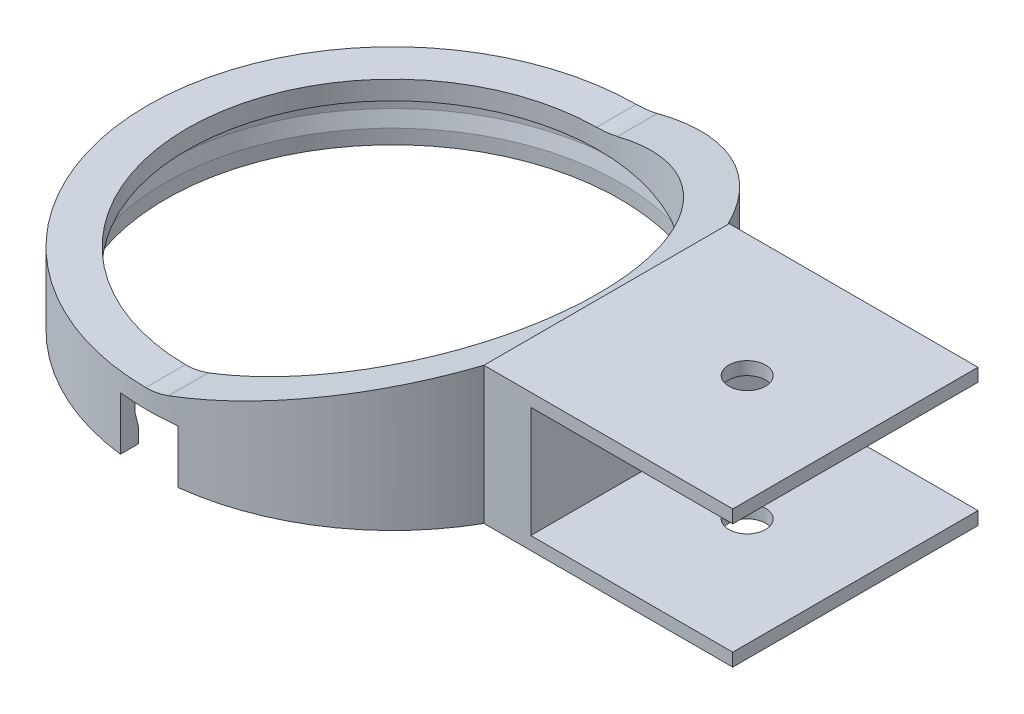
from build123d import *
from build123d.topology import SkipClean

# Parameters (mm, degrees)
SKETCH1_R                = 43.18
SKETCH1_R_2              = 38.1
SKETCH1_R_3              = 36.195
BOSS_EXTRUDE1_DEPTH      = 2.54
BOSS_EXTRUDE2_START      = 4.318
SKETCH2_R                = 43.18
SKETCH2_R_2              = 40.64
BOSS_EXTRUDE2_DEPTH      = 4.318
SKETCH7_W                = 5.08
SKETCH7_H                = 10.16
CUT_EXTRUDE1_DEPTH       = 12.7
SKETCH12_R               = 43.18
SKETCH12_R_2             = 36.195
BOSS_EXTRUDE3_DEPTH      = 12.192
BOSS_EXTRUDE4_REACH      = 99.671
BOSS_EXTRUDE4_END_RADIUS = 43.18
SKETCH13_W               = 43.18
SKETCH13_H               = 24.13
BOSS_EXTRUDE5_DEPTH      = 38.1
SKETCH14_W               = 38.608
SKETCH14_H               = 19.558
CUT_EXTRUDE2_DEPTH       = 35.56
SKETCH17_R               = 3.2385
CUT_EXTRUDE3_DEPTH       = 35.56
CUT_EXTRUDE5_DEPTH       = 88.9
FILLET1_R                = 12.7
SKETCH23_W               = 35.56
SKETCH23_H               = 19.558
CUT_EXTRUDE6_DEPTH       = 50.8


with BuildPart() as part:
    # Sketch1 → Boss-Extrude1 (new body)
    # profile 1 of 2: a face of its own
    with BuildSketch(Plane(origin=(0, 0, 0), x_dir=(1, 0, 0), z_dir=(0, 1, 0))):
        with Locations(Location((0, 0, 0), (0, 0, 270))):
            Circle(SKETCH1_R)
        Circle(SKETCH1_R_2, mode=Mode.SUBTRACT)
    # profile 2 of 2: a face of its own
    with BuildSketch(Plane(origin=(0, 0, 0), x_dir=(1, 0, 0), z_dir=(0, 1, 0))):
        Circle(SKETCH1_R_2)
        with Locations(Location((0, 0, 0), (0, 0, 270))):
            Circle(SKETCH1_R_3, mode=Mode.SUBTRACT)
    extrude(amount=BOSS_EXTRUDE1_DEPTH)

    # Sketch2 → Boss-Extrude2 (add)
    with BuildSketch(Plane.XZ.offset(BOSS_EXTRUDE2_START)):
        with Locations(Location((0, 0, 0), (0, 0, 270))):
            Circle(SKETCH2_R)
        with Locations(Location((0, 0, 0), (0, 0, 270))):
            Circle(SKETCH2_R_2, mode=Mode.SUBTRACT)
    extrude(amount=-BOSS_EXTRUDE2_DEPTH)

    # Sketch3 → Revolve1 (revolve)
    with BuildSketch(Plane.XY, mode=Mode.PRIVATE) as revolve1_sk:
        Polygon((-40.64, -4.318), (-43.18, -4.318), (-43.18, -9.398), (-40.005, -9.398), (-40.005, -6.858), align=None)
    revolve(revolve1_sk.sketch.rotate(Axis((0, 0, 0), (0, 1, 0)), 270), axis=Axis((0, 0, 0), (0, 1, 0)))

    # Sketch7 → Cut-Extrude1 (cut)
    with SkipClean():  # the faces are left unmerged after this step: merging them gives an invalid solid
        with BuildSketch(Plane.XY.offset(43.18)):
            with Locations((-2.54, -5.08)):
                Rectangle(SKETCH7_W, SKETCH7_H)
            with Locations((2.54, -5.08)):
                Rectangle(SKETCH7_W, SKETCH7_H)
        extrude(amount=-CUT_EXTRUDE1_DEPTH, mode=Mode.SUBTRACT)

    # Sketch12 → Boss-Extrude3 (add)
    with SkipClean():  # the faces are left unmerged after this step: merging them gives an invalid solid
        with BuildSketch(Plane(origin=(0, 2.54, 0), x_dir=(1, 0, 0), z_dir=(0, 1, 0))):
            with Locations(Location((0, 0, 0), (0, 0, 263.243672969))):
                Circle(SKETCH12_R)
            with Locations(Location((0, 0, 0), (0, 0, 270))):
                Circle(SKETCH12_R_2, mode=Mode.SUBTRACT)
        extrude(amount=BOSS_EXTRUDE3_DEPTH)

    # Boss-Extrude4: up to this cylinder (the profile starts outside it)
    with SkipClean():  # the faces are left unmerged after this step: merging them gives an invalid solid
        boss_extrude4_end = Plane(origin=(0, 2.667, 0), z_dir=(0, -1, 0)) * Cylinder(BOSS_EXTRUDE4_END_RADIUS, 286.702, mode=Mode.PRIVATE)
        # Sketch8 → Boss-Extrude4 (add, up to the surface)
        with BuildSketch(Plane(origin=(43.18, 0, 0), x_dir=(0, 0, -1), z_dir=(1, 0, 0)), mode=Mode.PRIVATE) as boss_extrude4_sk1:
            Polygon((0.14993237, -9.398), (21.73993237, -9.398), (21.73993237, 14.732), (-21.44006763, 14.732), (-21.44006763, -9.398), align=None)
        boss_extrude4_tool1 = extrude(boss_extrude4_sk1.sketch, amount=-BOSS_EXTRUDE4_REACH, mode=Mode.PRIVATE) - boss_extrude4_end
        add(boss_extrude4_tool1.solids().sort_by_distance((43.18, 2.667, -0.149932))[0])
        add(boss_extrude4_tool1.solids().sort_by_distance((43.18, 2.667, -0.149932))[1])

    # Sketch13 → Boss-Extrude5 (add)
    with SkipClean():  # the faces are left unmerged after this step: merging them gives an invalid solid
        with BuildSketch(Plane(origin=(43.18, 0, 0), x_dir=(0, 0, -1), z_dir=(1, 0, 0))):
            with Locations((0.14993237, 2.667)):
                Rectangle(SKETCH13_W, SKETCH13_H)
        extrude(amount=BOSS_EXTRUDE5_DEPTH)

    # Sketch14 → Cut-Extrude2 (cut)
    with SkipClean():  # the faces are left unmerged after this step: merging them gives an invalid solid
        with BuildSketch(Plane(origin=(81.28, 0, 0), x_dir=(0, 0, -1), z_dir=(1, 0, 0))):
            with Locations((0.14993237, 2.667)):
                Rectangle(SKETCH14_W, SKETCH14_H)
        extrude(amount=-CUT_EXTRUDE2_DEPTH, mode=Mode.SUBTRACT)

    # Sketch17 → Cut-Extrude3 (cut)
    with SkipClean():  # the faces are left unmerged after this step: merging them gives an invalid solid
        with BuildSketch(Plane(origin=(0, 14.732, 0), x_dir=(1, 0, 0), z_dir=(0, 1, 0))):
            with Locations(Location((62.23, 0.14993237, 0), (0, 0, 90))):
                Circle(SKETCH17_R)
        extrude(amount=-CUT_EXTRUDE3_DEPTH, mode=Mode.SUBTRACT)

    # Sketch22 → Cut-Extrude5 (cut)
    with SkipClean():  # the faces are left unmerged after this step: merging them gives an invalid solid
        with BuildSketch(Plane.XY.offset(43.18)):
            Polygon((37.481140591, 14.732), (1.651830342, 3.302), (-49.162594564, 3.302), (-49.162594564, 14.732), align=None)
        extrude(amount=-CUT_EXTRUDE5_DEPTH, mode=Mode.SUBTRACT)

    # Fillet1
    # the kernel refuses this fillet: 12.7 mm, written as the material it adds along each edge
    with BuildSketch(Plane(origin=(1.651830342, 3.302, -31.215644567), x_dir=(0.9526968361956157, 0.30392225700475445, 0), z_dir=(0, 0, -1))) as fillet1_piece_1_section:
        with BuildLine():
            CenterArc((FILLET1_R * 0.155642315474, -FILLET1_R), FILLET1_R, 90, 17.69333606)
            Line((-FILLET1_R * 0.14827994153, -FILLET1_R * 0.0473031638044), (0, 0))
            Line((0, 0), (FILLET1_R * 0.155642315474, 0))
        make_face()
    fillet1_piece_1 = extrude(amount=16.87439239, mode=Mode.PRIVATE)
    fillet1_piece_1 = fillet1_piece_1 & Plane(origin=(0, 3.342340144, 0), x_dir=(-0.11764705883067372, 0, 0.9930554715364556), z_dir=(0, -1, 0)) * Cylinder(43.18, 42, mode=Mode.PRIVATE)
    fillet1_piece_1 = fillet1_piece_1 - Plane(origin=(0, 3.342340144, 0), x_dir=(0, 0, 1), z_dir=(0, -1, 0)) * Cylinder(36.195, 42, mode=Mode.PRIVATE)
    add(fillet1_piece_1)
    with BuildSketch(Plane(origin=(1.651830342, 3.302, 48.090036957), x_dir=(0.9526968361956157, 0.30392225700475445, 0), z_dir=(0, 0, -1))) as fillet1_piece_2_section:
        with BuildLine():
            CenterArc((FILLET1_R * 0.155642315474, -FILLET1_R), FILLET1_R, 90, 17.69333606)
            Line((-FILLET1_R * 0.14827994153, -FILLET1_R * 0.0473031638044), (0, 0))
            Line((0, 0), (FILLET1_R * 0.155642315474, 0))
        make_face()
    fillet1_piece_2 = extrude(amount=16.87439239, mode=Mode.PRIVATE)
    fillet1_piece_2 = fillet1_piece_2 & Plane(origin=(0, 3.342340147, 0), x_dir=(-0.11764705883067372, 0, 0.9930554715364556), z_dir=(0, -1, 0)) * Cylinder(43.18, 42, mode=Mode.PRIVATE)
    fillet1_piece_2 = fillet1_piece_2 - Plane(origin=(0, 3.342340147, 0), x_dir=(0, 0, 1), z_dir=(0, -1, 0)) * Cylinder(36.195, 42, mode=Mode.PRIVATE)
    add(fillet1_piece_2)

    # Sketch23 → Cut-Extrude6 (cut)
    with BuildSketch(Plane.XY.offset(21.44006763)):
        with Locations((63.5, 2.667)):
            Rectangle(SKETCH23_W, SKETCH23_H)
    extrude(amount=-CUT_EXTRUDE6_DEPTH, mode=Mode.SUBTRACT)


solid = part.part
